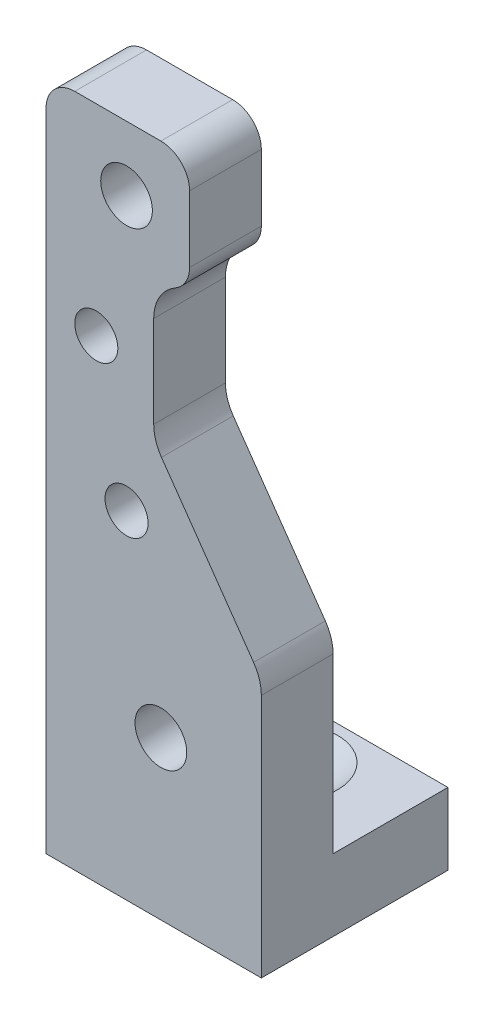
from build123d import *

# Parameters (mm, degrees)
EXTRUDE_1_DEPTH           = 10
EXTRUDE_1_DEPTH_BACK      = 5
EXTRUDE_2_DEPTH           = 5
RIB_4_REACH               = 54.517
SKETCH_2_WALL_W           = 119.839576518
SKETCH_2_WALL_H           = 3
HOLE_WIZARD_1_D           = 3.6
HOLE_WIZARD_1_CSINK_D     = 6.6
HOLE_WIZARD_1_CSINK_ANGLE = 90
MM_TRANSITIONAL_1_D       = 3
FILLET_1_R                = 3
FILLET_2_R                = 2
HOLE_WIZARD_2_D           = 3.6
HOLE_WIZARD_2_CSINK_D     = 6.6
HOLE_WIZARD_2_CSINK_ANGLE = 90


with BuildPart() as part:
    # 草图1 → 凸台-拉伸1 (new, two sides: drawn at the far end of the back side and taken through both)
    with BuildSketch(Plane(origin=(0, 0, 0), x_dir=(0, 0, -1), z_dir=(1, 0, 0)).offset(-EXTRUDE_1_DEPTH_BACK)):
        Polygon((13, 5), (5, 5), (5, 18), (0, 18), (0, 0), (13, 0), align=None)
    extrude(amount=EXTRUDE_1_DEPTH + EXTRUDE_1_DEPTH_BACK)

    # 草图3 → 凸台-拉伸2 (add)
    with BuildSketch(Plane(origin=(-10, 0, -5), x_dir=(-1, 0, 0), z_dir=(0, 0, -1))):
        Polygon((-5, 18), (-5, 47), (-15, 47), (-15, 39), (-12.5, 39), (-12.5, 28.711110051), (-20, 18), align=None)
    extrude(amount=-EXTRUDE_2_DEPTH)

    # 草图2 wall → 筋4 (add, up to next)
    with BuildSketch(Plane(origin=(-5, 10, -9), x_dir=(0, -0.780868809443, -0.624695047554), z_dir=(0, -0.624695047554, 0.780868809443)), mode=Mode.PRIVATE) as rib_4_sk1:
        with Locations((0, 1.5)):
            Rectangle(SKETCH_2_WALL_W, SKETCH_2_WALL_H)
    rib_4_tool1 = extrude(rib_4_sk1.sketch, amount=RIB_4_REACH, mode=Mode.PRIVATE) - part.part
    add(rib_4_tool1.solids().sort_by_distance((-5, 10, -9))[0])

    # 打孔尺寸(%根据十字)槽半沉头木螺钉的类型1 (through all)
    with Locations(Plane(origin=(0, 0, -5), x_dir=(-1, 0, 0), z_dir=(0, 0, -1))):
        with Locations((-3, 11), (-0.608074792, 42.508910889)):
            CounterSinkHole(HOLE_WIZARD_1_D / 2, HOLE_WIZARD_1_CSINK_D / 2, counter_sink_angle=HOLE_WIZARD_1_CSINK_ANGLE)

    # 大小mm Transitional 暗销孔1 (through all)
    with Locations(Plane(origin=(0, 0, -5), x_dir=(-1, 0, 0), z_dir=(0, 0, -1))):
        with Locations((1.5, 33), (-0.608074792, 23.491089111)):
            Hole(MM_TRANSITIONAL_1_D / 2)

    # 圆角1
    # the kernel refuses this fillet: 3 mm, written as the material it adds along each edge
    with BuildSketch(Plane(origin=(2.5, 28.711110051, -5), x_dir=(0.5735764363510514, -0.8191520442889881, 0), z_dir=(0, 0, 1))) as fillet_1_piece_1:
        with BuildLine():
            CenterArc((FILLET_1_R * 0.315298788879, FILLET_1_R), FILLET_1_R, 235, 35)
            Line((-FILLET_1_R * 0.258277647472, FILLET_1_R * 0.180847955711), (0, 0))
            Line((0, 0), (FILLET_1_R * 0.315298788879, 0))
        make_face()
    extrude(amount=5)
    with BuildSketch(Plane(origin=(2.5, 39, -5), x_dir=(0, -1, 0), z_dir=(0, 0, 1))) as fillet_1_piece_2:
        with BuildLine():
            CenterArc((2.958039892, 3), FILLET_1_R, 189.594068227, 80.405931773)
            Line((0, 2.5), (0, 0))
            Line((0, 0), (2.958039892, 0))
        make_face()
    extrude(amount=5)
    # the kernel refuses this fillet: 3 mm, written as the material it takes off along each edge
    with BuildSketch(Plane(origin=(10, 18, -7.364740917), x_dir=(0, -1, 0), z_dir=(0, 0, 1))) as fillet_1_2_piece_1:
        with BuildLine():
            CenterArc((FILLET_1_R * 0.315298788879, -FILLET_1_R), FILLET_1_R, 90, 35)
            Line((-FILLET_1_R * 0.258277647472, -FILLET_1_R * 0.180847955711), (0, 0))
            Line((0, 0), (FILLET_1_R * 0.315298788879, 0))
        make_face()
    extrude(amount=9.729481833, mode=Mode.SUBTRACT)

    # 圆角2
    fillet_2_edges = [part.edges().sort_by_distance(p)[0] for p in [
        (-5, 47, -2.5),
        (5, 47, -2.5),
        (5, 39, -2.5),
    ]]
    fillet(fillet_2_edges, radius=FILLET_2_R)

    # 打孔尺寸(%根据十字)槽半沉头木螺钉的类型2 (through all)
    with Locations(Plane(origin=(0, 5, 0), x_dir=(1, 0, 0), z_dir=(0, 1, 0))):
        with Locations((3, 9)):
            CounterSinkHole(HOLE_WIZARD_2_D / 2, HOLE_WIZARD_2_CSINK_D / 2, counter_sink_angle=HOLE_WIZARD_2_CSINK_ANGLE)


solid = part.part
